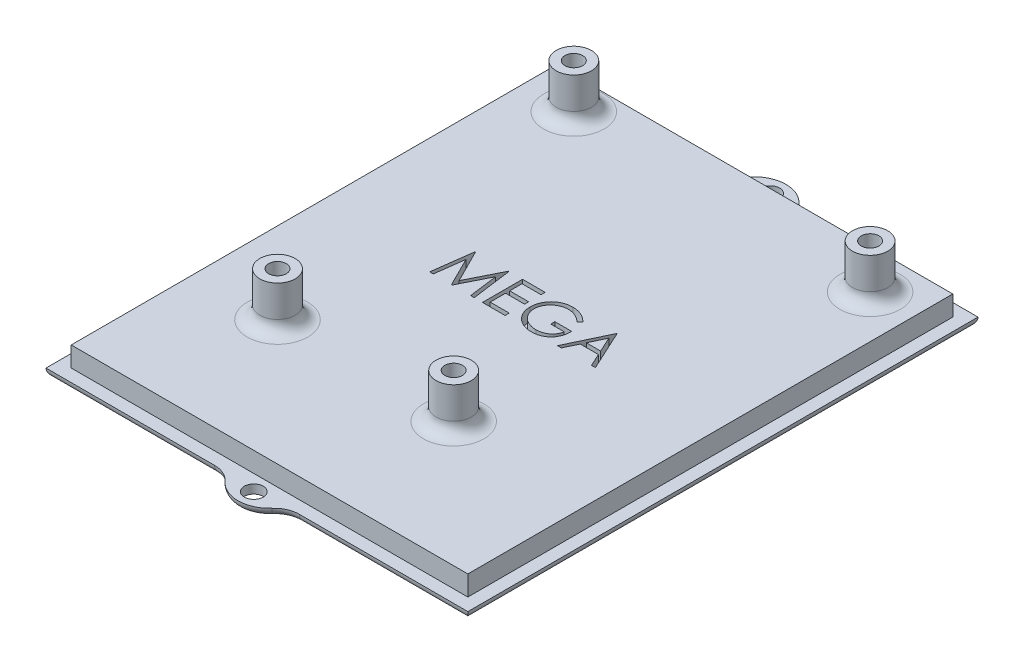
from build123d import *

# Parameters (mm, degrees)
SKETCH1_W           = 62.9
SKETCH1_H           = 76.9
BOSS_EXTRUDE1_DEPTH = 4.575
SKETCH2_R           = 2.7999972
SKETCH2_R_2         = 1.3999972
BOSS_EXTRUDE2_DEPTH = 7
CUT_EXTRUDE1_START  = -3.575
SKETCH3_R           = 1.3999972
CUT_EXTRUDE1_DEPTH  = 3.575
SKETCH7_W           = 66.9
SKETCH7_H           = 80.9
BOSS_EXTRUDE5_DEPTH = 1.4
BOSS_EXTRUDE3_DEPTH = 1.4
CUT_EXTRUDE3_REACH  = 57.77
SKETCH8_R           = 1.5
CUT_EXTRUDE2_DEPTH  = 2
FILLET1_R           = 1.4
FILLET2_R           = 2


with BuildPart() as part:
    # Sketch1 → Boss-Extrude1 (new body)
    with BuildSketch(Plane(origin=(0, 0, 0), x_dir=(1, 0, 0), z_dir=(0, 1, 0))):
        Rectangle(SKETCH1_W, SKETCH1_H)
    extrude(amount=BOSS_EXTRUDE1_DEPTH)

    # Sketch2 → Boss-Extrude2 (add)
    # profile 1 of 4: a face of its own
    with BuildSketch(Plane(origin=(0, 4.575, 0), x_dir=(1, 0, 0), z_dir=(0, 1, 0))):
        with Locations(Location((9.37, -18.62, 0), (0, 0, 270))):
            Circle(SKETCH2_R)
        with Locations(Location((9.37, -18.62, 0), (0, 0, 270))):
            Circle(SKETCH2_R_2, mode=Mode.SUBTRACT)
    # profile 2 of 4: a face of its own
    with BuildSketch(Plane(origin=(0, 4.575, 0), x_dir=(1, 0, 0), z_dir=(0, 1, 0))):
        with Locations(Location((24.61, 32.18, 0), (0, 0, 270))):
            Circle(SKETCH2_R)
        with Locations(Location((24.61, 32.18, 0), (0, 0, 270))):
            Circle(SKETCH2_R_2, mode=Mode.SUBTRACT)
    # profile 3 of 4: a face of its own
    with BuildSketch(Plane(origin=(0, 4.575, 0), x_dir=(1, 0, 0), z_dir=(0, 1, 0))):
        with Locations(Location((-23.65, 33.45, 0), (0, 0, 270))):
            Circle(SKETCH2_R)
        with Locations(Location((-23.65, 33.45, 0), (0, 0, 270))):
            Circle(SKETCH2_R_2, mode=Mode.SUBTRACT)
    # profile 4 of 4: a face of its own
    with BuildSketch(Plane(origin=(0, 4.575, 0), x_dir=(1, 0, 0), z_dir=(0, 1, 0))):
        with Locations(Location((-18.57, -18.62, 0), (0, 0, 270))):
            Circle(SKETCH2_R)
        with Locations(Location((-18.57, -18.62, 0), (0, 0, 270))):
            Circle(SKETCH2_R_2, mode=Mode.SUBTRACT)
    extrude(amount=BOSS_EXTRUDE2_DEPTH)

    # Sketch3 → Cut-Extrude1 (cut)
    with BuildSketch(Plane(origin=(0, 4.575, 0), x_dir=(1, 0, 0), z_dir=(0, 1, 0)).offset(CUT_EXTRUDE1_START)):
        with Locations(Location((9.37, -18.62, 0), (0, 0, 270))):
            Circle(SKETCH3_R)
        with Locations(Location((-18.57, -18.62, 0), (0, 0, 270))):
            Circle(SKETCH3_R)
        with Locations(Location((-23.65, 33.45, 0), (0, 0, 270))):
            Circle(SKETCH3_R)
        with Locations(Location((24.61, 32.18, 0), (0, 0, 270))):
            Circle(SKETCH3_R)
    extrude(amount=CUT_EXTRUDE1_DEPTH, mode=Mode.SUBTRACT)

    # Sketch7 → Boss-Extrude5 (add)
    with BuildSketch(Plane.XZ):
        Rectangle(SKETCH7_W, SKETCH7_H)
    extrude(amount=-BOSS_EXTRUDE5_DEPTH)

    # Sketch4 → Boss-Extrude3 (add)
    with BuildSketch(Plane(origin=(0, 0, 0), x_dir=(1, 0, 0), z_dir=(0, 1, 0))):
        with BuildLine():
            Line((-6.708203932, -40.45), (6.708203932, -40.45))
            ThreePointArc((6.708203932, -40.45), (5.075210771, -40.798516283), (3.726779962, -41.783333333))
            ThreePointArc((3.726779962, -41.783333333), (0, -43.45), (-3.726779962, -41.783333333))
            ThreePointArc((-3.726779962, -41.783333333), (-5.075210771, -40.798516283), (-6.708203932, -40.45))
        make_face()
    boss_extrude3 = extrude(amount=BOSS_EXTRUDE3_DEPTH)

    # Sketch8 → Cut-Extrude3 (cut, up to next)
    with BuildSketch(Plane(origin=(0, 1.4, 0), x_dir=(1, 0, 0), z_dir=(0, 1, 0)), mode=Mode.PRIVATE) as cut_extrude3_sk1:
        with Locations(Location((0, -40.95, 0), (0, 0, 270))):
            Circle(SKETCH8_R)
    cut_extrude3_tool1 = extrude(cut_extrude3_sk1.sketch, amount=-CUT_EXTRUDE3_REACH, mode=Mode.PRIVATE) & part.part
    cut_extrude3 = cut_extrude3_tool1.solids().sort_by_distance((0, 1.4, 40.95))[0]
    add(cut_extrude3, mode=Mode.SUBTRACT)

    # Mirror1: Boss-Extrude3, Cut-Extrude3 across plane
    add(boss_extrude3.mirror(Plane.XY))
    add(cut_extrude3.mirror(Plane.XY), mode=Mode.SUBTRACT)

    # Sketch5 → Cut-Extrude2 (cut)
    # profile 1 of 4: a face of its own
    with BuildSketch(Plane(origin=(0, 4.575, 0), x_dir=(1, 0, 0), z_dir=(0, 1, 0))):
        Polygon((-13.066346154, 0), (-12.22807492, 6.35), (-12.146664663, 6.35), (-9.525, 1.13974359), (-6.909695513, 6.35), (-6.827013221, 6.35), (-5.983653846, 0), (-6.556069712, 0), (-7.164102564, 4.569150641), (-9.456310096, 0), (-9.584785657, 0), (-11.885897436, 4.579326923), (-12.492658253, 0), align=None)
    # profile 2 of 4: a face of its own
    with BuildSketch(Plane(origin=(0, 4.575, 0), x_dir=(1, 0, 0), z_dir=(0, 1, 0))):
        Polygon((-4.681089744, 6.35), (-1.099038462, 6.35), (-1.099038462, 5.698717949), (-4.111217949, 5.698717949), (-4.111217949, 3.744871795), (-1.099038462, 3.744871795), (-1.099038462, 3.093589744), (-4.111217949, 3.093589744), (-4.111217949, 0.651282051), (-1.099038462, 0.651282051), (-1.099038462, 0), (-4.681089744, 0), align=None)
    # profile 3 of 4: a face of its own
    with BuildSketch(Plane(origin=(0, 4.575, 0), x_dir=(1, 0, 0), z_dir=(0, 1, 0))):
        with BuildLine():
            Line((5.983653846, 5.266225962), (5.495192308, 4.803205128))
            add(Edge.make_bspline(
                [(5.495192308, 4.803205128), (5.406802325, 4.886355408), (5.232130069, 5.050673202), (4.947359343, 5.263871722), (4.650245322, 5.44650879), (4.342338363, 5.595110104), (4.031263558, 5.713678684), (3.721149921, 5.798094024), (3.415178434, 5.851928485), (3.211675052, 5.858366241), (3.111398237, 5.861538462)],
                knots=[0, 0, 0, 0, 1.08915593, 2.152340314, 3.188132944, 4.216796309, 5.218260357, 6.173443236, 7.099959455, 8, 8, 8, 8], degree=3))
            add(Edge.make_bspline(
                [(3.111398237, 5.861538462), (3.049867282, 5.860788062), (2.926964954, 5.85928921), (2.744407998, 5.840158991), (2.563765671, 5.812645595), (2.385378977, 5.772836759), (2.208901071, 5.72238318), (2.034945738, 5.659272411), (1.86318848, 5.585693611), (1.695247162, 5.500671694), (1.532432248, 5.407272544), (1.378659132, 5.303770192), (1.23294768, 5.193481959), (1.098036623, 5.07364661), (0.973149927, 4.94534964), (0.855315024, 4.810977642), (0.748676215, 4.66685946), (0.652353673, 4.515646681), (0.566426165, 4.359995138), (0.490573323, 4.201402999), (0.426897177, 4.040396292), (0.376515451, 3.87677298), (0.334948979, 3.71179891), (0.305707034, 3.544331774), (0.289221124, 3.374192259), (0.286369466, 3.26026009), (0.284935897, 3.202984776)],
                knots=[0, 0, 0, 0, 1.02818874, 2.053710826, 3.065248034, 4.081641283, 5.106893873, 6.131558223, 7.173050175, 8.228653731, 9.27666206, 10.308777013, 11.325269123, 12.329503258, 13.32196095, 14.316845687, 15.314881793, 16.315733098, 17.311955233, 18.285320748, 19.252783886, 20.203351036, 21.145449891, 22.095197417, 23.042428769, 24, 24, 24, 24], degree=3))
            add(Edge.make_bspline(
                [(0.284935897, 3.202984776), (0.286306986, 3.144436293), (0.28904542, 3.027499204), (0.306572, 2.852975672), (0.33909895, 2.681044157), (0.382583222, 2.511139687), (0.436976988, 2.34297128), (0.504781682, 2.177268012), (0.585092129, 2.014036016), (0.678049873, 1.854746054), (0.779987699, 1.699582855), (0.894184432, 1.553424865), (1.015488633, 1.414325798), (1.148319566, 1.285374055), (1.288417878, 1.163120415), (1.439969293, 1.05093311), (1.599993757, 0.946651191), (1.768735413, 0.851588935), (1.944363318, 0.766664877), (2.124443428, 0.691147237), (2.309551036, 0.628954725), (2.498713344, 0.578267022), (2.691704851, 0.53671934), (2.889505179, 0.509990411), (3.09065995, 0.490594189), (3.226257183, 0.489176017), (3.294571314, 0.488461538)],
                knots=[0, 0, 0, 0, 0.93586088, 1.869166235, 2.799637598, 3.729985548, 4.670839027, 5.622275134, 6.589130586, 7.576015415, 8.568469353, 9.55398029, 10.53834874, 11.515998671, 12.510579167, 13.508179873, 14.527009472, 15.561807829, 16.601455013, 17.643573243, 18.680854198, 19.719860599, 20.772568776, 21.833555941, 22.908541556, 24, 24, 24, 24], degree=3))
            add(Edge.make_bspline(
                [(3.294571314, 0.488461538), (3.376900601, 0.490182527), (3.538567532, 0.493561967), (3.776214364, 0.519869635), (4.004457078, 0.560957389), (4.222654333, 0.621129802), (4.431059556, 0.697880755), (4.630436749, 0.790400956), (4.819216187, 0.902239078), (4.997965374, 1.028465951), (5.162624839, 1.169100004), (5.311131607, 1.320854944), (5.441116994, 1.482994151), (5.554518377, 1.654562652), (5.64833265, 1.836980562), (5.725336007, 2.029353925), (5.784360693, 2.231769268), (5.808590433, 2.371635515), (5.820833333, 2.442307692)],
                knots=[0, 0, 0, 0, 1.13008108, 2.219097802, 3.278683437, 4.311054135, 5.322181354, 6.324827112, 7.324222904, 8.330512327, 9.32562643, 10.293043162, 11.24128371, 12.174520618, 13.111833804, 14.052305215, 15.015860969, 16, 16, 16, 16], degree=3))
            Line((5.820833333, 2.442307692), (3.704166667, 2.442307692))
            Line((3.704166667, 2.442307692), (3.704166667, 3.093589744))
            Line((3.704166667, 3.093589744), (6.390705128, 3.093589744))
            add(Edge.make_bspline(
                [(6.390705128, 3.093589744), (6.387610232, 2.972200442), (6.381552961, 2.734619652), (6.339064357, 2.388145018), (6.270454399, 2.060899232), (6.176727833, 1.752537659), (6.055396967, 1.463497283), (5.907763951, 1.193484641), (5.73146596, 0.944244091), (5.53278273, 0.713740899), (5.309807093, 0.508129328), (5.068564025, 0.327415698), (4.808654954, 0.175192381), (4.530325732, 0.051348037), (4.234487517, -0.045306211), (3.920455742, -0.113834643), (3.588656267, -0.154891862), (3.361259724, -0.160137651), (3.244961939, -0.162820513)],
                knots=[0, 0, 0, 0, 1.140356446, 2.231883559, 3.274166699, 4.278491846, 5.25512956, 6.21435461, 7.1637429, 8.11826594, 9.068280886, 10.0076534, 10.945064095, 11.891975133, 12.864533718, 13.863980011, 14.907571808, 16, 16, 16, 16], degree=3))
            add(Edge.make_bspline(
                [(3.244961939, -0.162820513), (3.173279265, -0.161787964), (3.031897929, -0.159751446), (2.823090102, -0.145278258), (2.620039562, -0.122997784), (2.422775888, -0.089351632), (2.230573468, -0.048140759), (2.044392221, 0.004630859), (1.863522917, 0.0657155), (1.687686, 0.135194793), (1.518477466, 0.215697656), (1.355143642, 0.30515943), (1.196781671, 0.403118813), (1.044470272, 0.511269919), (0.897415844, 0.628803811), (0.756566596, 0.755956064), (0.621134018, 0.892337953), (0.536297177, 0.989182727), (0.493549679, 1.037980769)],
                knots=[0, 0, 0, 0, 1.107784379, 2.184907829, 3.233506516, 4.263428166, 5.276301166, 6.270063455, 7.25232949, 8.225834625, 9.190232166, 10.146266622, 11.1027726, 12.066435141, 13.031522626, 14.010570082, 14.99756817, 16, 16, 16, 16], degree=3))
            add(Edge.make_bspline(
                [(0.493549679, 1.037980769), (0.431526632, 1.115397525), (0.308510054, 1.268945999), (0.150162542, 1.514963041), (0.015177139, 1.769692131), (-0.094347338, 2.033842385), (-0.179869295, 2.307166728), (-0.241203496, 2.589315899), (-0.277139578, 2.880653229), (-0.28231671, 3.077803066), (-0.284935897, 3.177544071)],
                knots=[0, 0, 0, 0, 1.023165419, 2.029347347, 3.013907458, 3.994755782, 4.975994455, 5.96558838, 6.970761222, 8, 8, 8, 8], degree=3))
            add(Edge.make_bspline(
                [(-0.284935897, 3.177544071), (-0.283970265, 3.252231415), (-0.282051274, 3.400656872), (-0.258782123, 3.62101513), (-0.225396693, 3.837460672), (-0.176325609, 4.049816567), (-0.114465243, 4.25822464), (-0.037261061, 4.462781661), (0.052627536, 4.663608342), (0.157104079, 4.85932236), (0.273371598, 5.047326651), (0.39955557, 5.22686438), (0.537447816, 5.39466597), (0.684796481, 5.552856531), (0.843359591, 5.699448725), (1.011651689, 5.835799755), (1.189802468, 5.96209252), (1.378372394, 6.076337792), (1.574546908, 6.17896036), (1.777855767, 6.268929359), (1.988236912, 6.343284803), (2.204114192, 6.406374374), (2.427121658, 6.453028986), (2.655640989, 6.486863139), (2.890863335, 6.510014512), (3.049860131, 6.511876434), (3.130478766, 6.512820513)],
                knots=[0, 0, 0, 0, 1.008945113, 2.00506715, 2.99143336, 3.967273523, 4.948097931, 5.927297278, 6.919902385, 7.919676788, 8.923139349, 9.905703106, 10.883022732, 11.856032218, 12.825136022, 13.798837087, 14.781400844, 15.773989409, 16.776158564, 17.77167057, 18.775803737, 19.789618931, 20.80898985, 21.851988756, 22.910860228, 24, 24, 24, 24], degree=3))
            add(Edge.make_bspline(
                [(3.130478766, 6.512820513), (3.196225294, 6.511769149), (3.326592932, 6.509684419), (3.520586761, 6.495234272), (3.711582088, 6.472330944), (3.899862109, 6.441076632), (4.084785659, 6.398506793), (4.266879539, 6.347564762), (4.446407712, 6.288252456), (4.622807536, 6.217515549), (4.797265106, 6.137226829), (4.970750445, 6.046851049), (5.142670792, 5.944842826), (5.313324286, 5.830899269), (5.483787057, 5.706977353), (5.651362908, 5.56953283), (5.820096821, 5.423985831), (5.928594399, 5.319333868), (5.983653846, 5.266225962)],
                knots=[0, 0, 0, 0, 0.985871117, 1.954866573, 2.915460327, 3.869826059, 4.81536089, 5.759505086, 6.70452669, 7.649098992, 8.607881297, 9.583363685, 10.581137262, 11.603961102, 12.659522466, 13.73993555, 14.853081303, 16, 16, 16, 16], degree=3))
        make_face()
    # profile 4 of 4: a face of its own
    with BuildSketch(Plane(origin=(0, 4.575, 0), x_dir=(1, 0, 0), z_dir=(0, 1, 0))):
        Polygon((10.298397436, 6.35), (13.229166667, 0), (12.609685497, 0), (11.670923478, 2.03525641), (8.792307692, 2.03525641), (7.826832933, 0), (7.204807692, 0), (10.216987179, 6.35), align=None)
        Polygon((10.251332131, 5.112309696), (9.10141226, 2.686538462), (11.370723157, 2.686538462), align=None, mode=Mode.SUBTRACT)
    extrude(amount=-CUT_EXTRUDE2_DEPTH, mode=Mode.SUBTRACT)

    # Fillet1
    # the kernel refuses this fillet: 1.4 mm, written as the material it takes off along each edge
    with BuildSketch(Plane(origin=(6.708203932, 0, -40.45), x_dir=(0, 0, 1), z_dir=(1, 0, 0)), Plane(origin=(-36.95, 0, -40.45), x_dir=(0, 0, 1), z_dir=(1, 0, 0)), Plane(origin=(-6.708203932, 0, 40.45), x_dir=(0, 0, -1), z_dir=(-1, 0, 0)), Plane(origin=(36.95, 0, 40.45), x_dir=(0, 0, -1), z_dir=(-1, 0, 0))) as fillet1_piece_1:
        with BuildLine():
            CenterArc((FILLET1_R, -FILLET1_R), FILLET1_R, 90, 90)
            Line((0, -FILLET1_R), (0, 0))
            Line((0, 0), (FILLET1_R, 0))
        make_face()
    extrude(amount=30.241796068, mode=Mode.SUBTRACT)
    with BuildSketch(Plane(origin=(6.708203932, 0, -44.45), x_dir=(0, 0, 1), z_dir=(1, 0, 0))) as fillet1_piece_2:
        with BuildLine():
            CenterArc((4 + FILLET1_R, -FILLET1_R), FILLET1_R, 90, 90)
            Line((4, -FILLET1_R), (4, 0))
            Line((4, 0), (4 + FILLET1_R, 0))
        make_face()
    revolve(axis=Axis((6.708203932, 0, -44.45), (0, -1, 0)), revolution_arc=48.189685104, mode=Mode.SUBTRACT)
    with BuildSketch(Plane(origin=(0, 0, -38.45), x_dir=(0.7453559924999307, 0, -0.6666666666666657), z_dir=(0.6666666666666657, 0, 0.7453559924999307))) as fillet1_piece_3:
        with BuildLine():
            CenterArc((5 - FILLET1_R, FILLET1_R), FILLET1_R, 270, 90)
            Line((5, FILLET1_R), (5, 0))
            Line((5, 0), (5 - FILLET1_R, 0))
        make_face()
    revolve(axis=Axis((0, 0, -38.45), (0, 1, 0)), revolution_arc=96.379370208, mode=Mode.SUBTRACT)
    with BuildSketch(Plane(origin=(-6.708203932, 0, -44.45), x_dir=(0.7453559924999269, 0, 0.6666666666666702), z_dir=(0.6666666666666702, 0, -0.7453559924999269))) as fillet1_piece_4:
        with BuildLine():
            CenterArc((4 + FILLET1_R, -FILLET1_R), FILLET1_R, 90, 90)
            Line((4, -FILLET1_R), (4, 0))
            Line((4, 0), (4 + FILLET1_R, 0))
        make_face()
    revolve(axis=Axis((-6.708203932, 0, -44.45), (0, -1, 0)), revolution_arc=48.189685104, mode=Mode.SUBTRACT)
    with BuildSketch(Plane(origin=(-33.45, 0, 43.95), x_dir=(1, 0, 0), z_dir=(0, 0, -1)), Plane(origin=(33.45, 0, -43.95), x_dir=(-1, 0, 0), z_dir=(0, 0, 1))) as fillet1_piece_5:
        with BuildLine():
            CenterArc((FILLET1_R, -FILLET1_R), FILLET1_R, 90, 90)
            Line((0, -FILLET1_R), (0, 0))
            Line((0, 0), (FILLET1_R, 0))
        make_face()
    extrude(amount=87.9, mode=Mode.SUBTRACT)
    with BuildSketch(Plane(origin=(-6.708203932, 0, 44.45), x_dir=(0.7453559924999269, 0, -0.6666666666666702), z_dir=(0.6666666666666702, 0, 0.7453559924999269))) as fillet1_piece_6:
        with BuildLine():
            CenterArc((4 + FILLET1_R, FILLET1_R), FILLET1_R, 180, 90)
            Line((4, FILLET1_R), (4, 0))
            Line((4, 0), (4 + FILLET1_R, 0))
        make_face()
    revolve(axis=Axis((-6.708203932, 0, 44.45), (0, 1, 0)), revolution_arc=48.189685104, mode=Mode.SUBTRACT)
    with BuildSketch(Plane(origin=(0, 0, 38.45), x_dir=(0.7453559924999307, 0, 0.6666666666666657), z_dir=(0.6666666666666657, 0, -0.7453559924999307))) as fillet1_piece_7:
        with BuildLine():
            CenterArc((5 - FILLET1_R, -FILLET1_R), FILLET1_R, 0, 90)
            Line((5, -FILLET1_R), (5, 0))
            Line((5, 0), (5 - FILLET1_R, 0))
        make_face()
    revolve(axis=Axis((0, 0, 38.45), (0, -1, 0)), revolution_arc=96.379370208, mode=Mode.SUBTRACT)
    with BuildSketch(Plane(origin=(6.708203932, 0, 44.45), x_dir=(0, 0, -1), z_dir=(1, 0, 0))) as fillet1_piece_8:
        with BuildLine():
            CenterArc((4 + FILLET1_R, FILLET1_R), FILLET1_R, 180, 90)
            Line((4, FILLET1_R), (4, 0))
            Line((4, 0), (4 + FILLET1_R, 0))
        make_face()
    revolve(axis=Axis((6.708203932, 0, 44.45), (0, 1, 0)), revolution_arc=48.189685104, mode=Mode.SUBTRACT)

    # Fillet2
    fillet2_edges = [part.edges().sort_by_distance(p)[0] for p in [
        (9.37, 4.575, 15.8200028),
        (24.61, 4.575, -34.9799972),
        (-23.65, 4.575, -36.2499972),
        (-18.57, 4.575, 15.8200028),
    ]]
    fillet(fillet2_edges, radius=FILLET2_R)


solid = part.part
